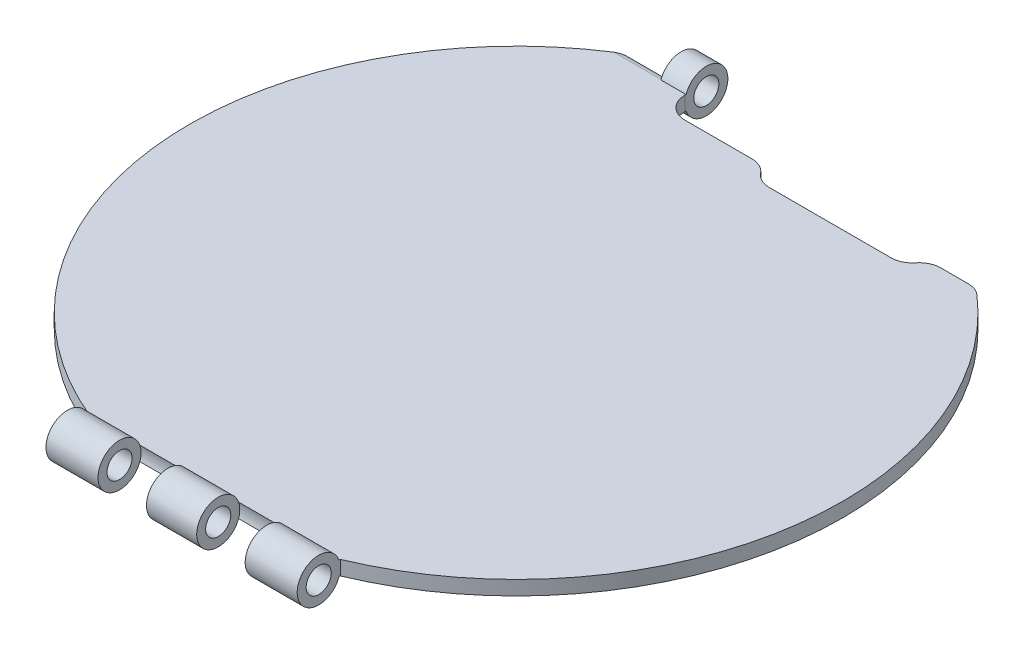
from build123d import *

# Parameters (mm, degrees)
BOSS_EXTRUDE1_DEPTH = 2
BOSS_EXTRUDE2_START = -17.5
SKETCH2_R           = 1.75
BOSS_EXTRUDE2_DEPTH = 35
SKETCH3_R           = 3
CUT_EXTRUDE1_DEPTH  = 6.75
CUT_EXTRUDE2_DEPTH  = 2
BOSS_EXTRUDE4_START = -0.5
BOSS_EXTRUDE4_DEPTH = 3.5
SKETCH6_R           = 1.75
CUT_EXTRUDE3_DEPTH  = 77.941536247
FILLET1_R           = 1
SKETCH7_W           = 9
SKETCH7_H           = 6
CUT_EXTRUDE4_DEPTH  = 2
FILLET2_R           = 3
FILLET3_R           = 3


# Some blends are built 0.0001 mm under size
with BuildPart() as part:
    # Sketch1 → Boss-Extrude1 (new body)
    with BuildSketch(Plane(origin=(0, 0, 0), x_dir=(1, 0, 0), z_dir=(0, 1, 0))):
        with BuildLine():
            Line((-17.5, -42), (17.5, -42))
            ThreePointArc((17.5, -42), (45.5, 0), (17.5, 42))
            Line((17.5, 42), (-17.5, 42))
            ThreePointArc((-17.5, 42), (-45.5, 0), (-17.5, -42))
        make_face()
    extrude(amount=BOSS_EXTRUDE1_DEPTH)

    # Sketch2 → Boss-Extrude2 (add)
    with BuildSketch(Plane(origin=(0, 0, 0), x_dir=(0, 0, -1), z_dir=(1, 0, 0)).offset(BOSS_EXTRUDE2_START)):
        with BuildLine():
            Line((-42, 0), (-42.171572875, 0))
            ThreePointArc((-42.171572875, 0), (-48, 1), (-42.171572875, 2))
            Line((-42.171572875, 2), (-42, 2))
            Line((-42, 2), (-42, 1))
            Line((-42, 1), (-42, 0))
        make_face()
        with Locations((-45, 1)):
            Circle(SKETCH2_R, mode=Mode.SUBTRACT)
    extrude(amount=BOSS_EXTRUDE2_DEPTH)

    # Sketch3 → Cut-Extrude1 (cut)
    with BuildSketch(Plane(origin=(3.5, 0, 0), x_dir=(0, 0, -1), z_dir=(1, 0, 0))):
        with Locations((-45, 1)):
            Circle(SKETCH3_R)
    cut_extrude1 = extrude(amount=CUT_EXTRUDE1_DEPTH, mode=Mode.SUBTRACT)

    # Mirror1: Cut-Extrude1 across plane
    add(cut_extrude1.mirror(Plane(origin=(0, 0, 0), x_dir=(0, 0, 1), z_dir=(1, 0, 0))), mode=Mode.SUBTRACT)

    # Sketch4 → Cut-Extrude2 (cut)
    with BuildSketch(Plane(origin=(0, 2, 0), x_dir=(1, 0, 0), z_dir=(0, 1, 0))):
        Polygon((0.75, 42), (21.25, 42), (21.25, 32.75), (0.75, 32.75), (0.75, 35), (-17.5, 35), (-17.5, 42), align=None)
    extrude(amount=-CUT_EXTRUDE2_DEPTH, mode=Mode.SUBTRACT)

    # Sketch5 → Boss-Extrude4 (add)
    with BuildSketch(Plane(origin=(-17.5, 0, 0), x_dir=(0, 0, -1), z_dir=(1, 0, 0)).offset(BOSS_EXTRUDE4_START)):
        with BuildLine():
            Line((35, 1), (35, 2))
            Line((35, 2), (38.171572875, 2))
            ThreePointArc((38.171572875, 2), (44, 1), (38.171572875, 0))
            Line((38.171572875, 0), (35, 0))
            Line((35, 0), (35, 1))
        make_face()
    extrude(amount=BOSS_EXTRUDE4_DEPTH)

    # Sketch6 → Cut-Extrude3 (cut, through all)
    with BuildSketch(Plane(origin=(-14.5, 0, 0), x_dir=(0, 0, -1), z_dir=(1, 0, 0))):
        with Locations((41, 1)):
            Circle(SKETCH6_R)
    extrude(amount=-CUT_EXTRUDE3_DEPTH, mode=Mode.SUBTRACT)

    # Fillet1
    fillet1_edges = [part.edges().sort_by_distance(p)[0] for p in [
        (-20.235557777, 0, -39.563859338),
        (-20.235557777, 2, -39.563859338),
    ]]
    fillet(fillet1_edges, radius=FILLET1_R - 0.0001)  # a hair under: the kernel refuses the full size

    # Sketch7 → Cut-Extrude4 (cut)
    with BuildSketch(Plane(origin=(0, 2, 0), x_dir=(1, 0, 0), z_dir=(0, 1, 0))):
        with Locations((24.75, 38)):
            Rectangle(SKETCH7_W, SKETCH7_H)
    extrude(amount=-CUT_EXTRUDE4_DEPTH, mode=Mode.SUBTRACT)

    # Fillet2
    # the kernel refuses this fillet: 3 mm, written as the material it adds along each edge
    with BuildSketch(Plane(origin=(-14.5, 0, -35), x_dir=(0, 0, -1), z_dir=(0, 1, 0))) as fillet2_piece_1:
        with BuildLine():
            CenterArc((FILLET2_R, -FILLET2_R), FILLET2_R, 90, 90)
            Line((0, -FILLET2_R), (0, 0))
            Line((0, 0), (FILLET2_R, 0))
        make_face()
    extrude(amount=2)
    # the kernel refuses this fillet: 3 mm, written as the material it takes off along each edge
    with BuildSketch(Plane(origin=(29.07318352, 4.856917414, -35), x_dir=(-1, 0, 0), z_dir=(0, -1, 0))) as fillet2_2_piece_1:
        with BuildLine():
            CenterArc((1.104450978, -3), FILLET2_R, 90, 41.15420196)
            ThreePointArc((-0.869812495, -0.741176471), (-0.43723324, -0.367857378), (0, 0))
            Line((0, 0), (1.104450978, 0))
        make_face()
    extrude(amount=7.713834827, mode=Mode.SUBTRACT)
    with BuildSketch(Plane(origin=(21.25, -7.261843774, -35), x_dir=(0, 0, 1), z_dir=(0, 1, 0))) as fillet2_2_piece_2:
        with BuildLine():
            CenterArc((3, 2.90473751), FILLET2_R, 180, 75.522487814)
            Line((0, 2.90473751), (0, 0))
            Line((0, 0), (2.25, 0))
        make_face()
    extrude(amount=16.523687548, mode=Mode.SUBTRACT)
    with BuildSketch(Plane(origin=(0.75, 9.261843774, -35), x_dir=(-1, 0, 0), z_dir=(0, -1, 0))) as fillet2_2_piece_3:
        with BuildLine():
            CenterArc((2.90473751, -3), FILLET2_R, 90, 75.522487814)
            Line((0, -2.25), (0, 0))
            Line((0, 0), (2.90473751, 0))
        make_face()
    extrude(amount=16.523687548, mode=Mode.SUBTRACT)

    # Fillet3
    fillet3_edges = [part.edges().sort_by_distance(p)[0] for p in [
        (21.25, 1, -32.75),
        (0.75, 1, -32.75),
    ]]
    fillet(fillet3_edges, radius=FILLET3_R)


solid = part.part
